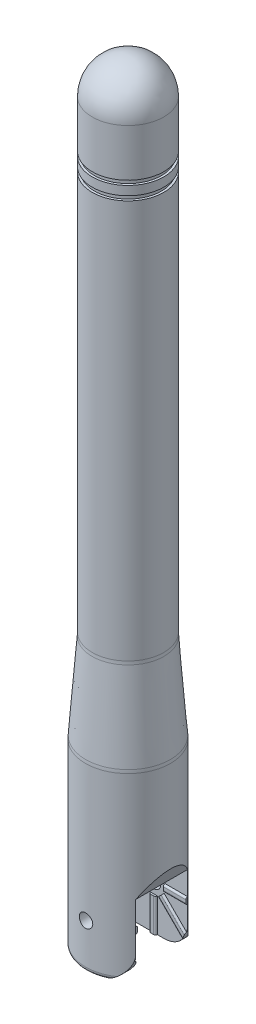
from build123d import *

# Parameters (mm, degrees)
ESQUISSE3_W                  = 7.5
ESQUISSE3_H                  = 5.8
ENL_V_MAT_EXTRU_1_DEPTH      = 8
CONG_1_R                     = 0.5
ENL_V_MAT_EXTRU_2_DEPTH      = 87.712791632
ENL_V_MAT_EXTRU_2_DEPTH_BACK = 87.712791632
ESQUISSE4_R                  = 0.75
ESQUISSE5_W                  = 0.75
ESQUISSE5_H                  = 3.75
ESQUISSE5_W_2                = 2.511980861
ESQUISSE5_H_2                = 0.75
BOSS_EXTRU_1_DEPTH           = 0.2
CONG_2_R                     = 0.2
CONG_2_OF_SYM_TRIE1_R        = 0.2
ENL_V_MAT_EXTRU_3_DEPTH      = 87.919895497


with BuildPart() as part:
    # Esquisse2 → Révolution1 (revolve)
    with BuildSketch(Plane.XY):
        with BuildLine():
            Line((4.014003451, 30.213287326), (4.735996549, 20.586712674))
            ThreePointArc((4.735996549, 20.586712674), (4.746497911, 20.399868856), (4.75, 20.212762933))
            Line((4.75, 20.212762933), (4.75, 0))
            Line((4.75, 0), (1, 0))
            Line((1, 0), (1, 82.452202))
            Line((1, 82.452202), (0, 82.452202))
            Line((0, 82.452202), (0, 86.452202))
            ThreePointArc((0, 86.452202), (2.828427125, 85.280629125), (4, 82.452202))
            Line((4, 82.452202), (4, 77.152202))
            Line((4, 77.152202), (3.75, 77.152202))
            Line((3.75, 77.152202), (3.75, 76.652202))
            Line((3.75, 76.652202), (4, 76.652202))
            Line((4, 76.652202), (4, 75.652202))
            Line((4, 75.652202), (3.75, 75.652202))
            Line((3.75, 75.652202), (3.75, 75.152202))
            Line((3.75, 75.152202), (4, 75.152202))
            Line((4, 75.152202), (4, 30.587237067))
            ThreePointArc((4, 30.587237067), (4.003502089, 30.400131144), (4.014003451, 30.213287326))
        make_face()
    revolve(axis=Axis((0, 0, 0), (0, 1, 0)))

    # Esquisse3 → Enlèv. mat.-Extru.1 (cut)
    with BuildSketch(Plane.XZ):
        with Locations((1, 0)):
            Rectangle(ESQUISSE3_W, ESQUISSE3_H)
    extrude(amount=-ENL_V_MAT_EXTRU_1_DEPTH, mode=Mode.SUBTRACT)

    # Congé1
    cong_1_edges = [part.edges().sort_by_distance(p)[0] for p in [
        (-4.75, 0, 0),
    ]]
    fillet(cong_1_edges, radius=CONG_1_R)

    # Esquisse4 → Enlèv. mat.-Extru.2 (cut, two sides: drawn at the far end of the back side and taken through both)
    with BuildSketch(Plane.XY.offset(-ENL_V_MAT_EXTRU_2_DEPTH_BACK)):
        with Locations((0, 5)):
            Circle(ESQUISSE4_R)
        with BuildLine():
            Line((1.161980861, 0), (3.761980861, 0))
            Line((3.761980861, 0), (3.761980861, 2.6))
            ThreePointArc((3.761980861, 2.6), (3.000458492, 0.761522369), (1.161980861, 0))
        make_face()
        Polygon((3.761980861, 8), (4.75, 10), (4.75, 8), align=None)
    extrude(amount=ENL_V_MAT_EXTRU_2_DEPTH + ENL_V_MAT_EXTRU_2_DEPTH_BACK, mode=Mode.SUBTRACT)

    # Esquisse5 → Boss.-Extru.1 (add)
    with BuildSketch(Plane.XY.offset(-2.9)):
        with Locations((0, 1.875)):
            Rectangle(ESQUISSE5_W, ESQUISSE5_H)
        Polygon((0.618718434, 3.850951481), (1.149048519, 4.381281566), (4.027145904, 1.503184182), (3.496815818, 0.972854096), align=None)
        with Locations((2.50599043, 5)):
            Rectangle(ESQUISSE5_W_2, ESQUISSE5_H_2)
    boss_extru_1 = extrude(amount=BOSS_EXTRU_1_DEPTH)

    # Congé2
    cong_2_edges = [part.edges().sort_by_distance(p)[0] for p in [
        (2.505990431, 5.375, -2.7),
        (2.505990431, 4.625, -2.7),
        (2.588097212, 2.942232874, -2.7),
        (2.057767126, 2.411902788, -2.7),
        (-0.375, 1.875, -2.7),
        (0.375, 1.875, -2.7),
    ]]
    fillet(cong_2_edges, radius=CONG_2_R - 0.0001)  # a hair under: the kernel refuses the full size

    # Symétrie1: Boss.-Extru.1 across plane
    add(boss_extru_1.mirror(Plane.XY))

    # Congé2 of Symétrie1
    cong_2_of_sym_trie1_edges = [part.edges().sort_by_distance(p)[0] for p in [
        (2.505990431, 5.375, 2.7),
        (2.505990431, 4.625, 2.7),
        (2.588097212, 2.942232874, 2.7),
        (2.057767126, 2.411902788, 2.7),
        (-0.375, 1.875, 2.7),
        (0.375, 1.875, 2.7),
    ]]
    fillet(cong_2_of_sym_trie1_edges, radius=CONG_2_OF_SYM_TRIE1_R - 0.0001)  # a hair under: the kernel refuses the full size

    # Esquisse6 → Enlèv. mat.-Extru.3 (cut, through all)
    with BuildSketch(Plane.XY.offset(2.9)):
        with BuildLine():
            Line((4.027145904, 1.503184182), (3.658059706, 1.87227038))
            ThreePointArc((3.658059706, 1.87227038), (3.516870908, 1.49795968), (3.319930166, 1.149739748))
            Line((3.319930166, 1.149739748), (3.496815818, 0.972854096))
            Line((3.496815818, 0.972854096), (4.027145904, 1.503184182))
        make_face()
    extrude(amount=-ENL_V_MAT_EXTRU_3_DEPTH, mode=Mode.SUBTRACT)


solid = part.part
